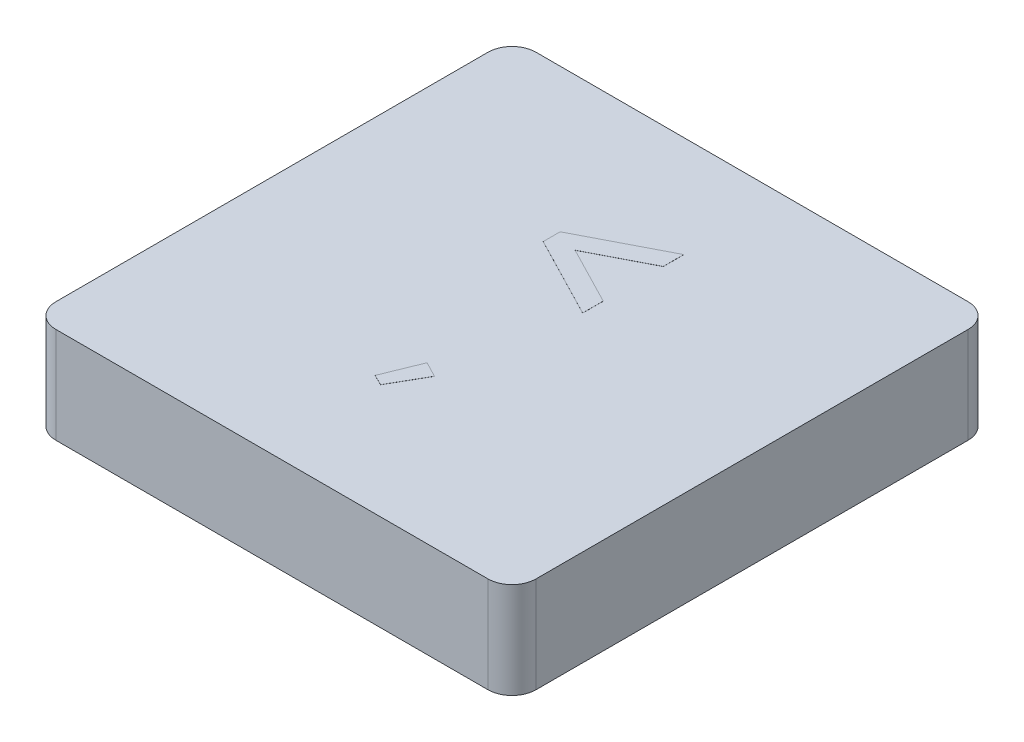
from build123d import *

# Parameters (mm, degrees)
SKETCH1_W           = 12.7
SKETCH1_H           = 12.7
BOSS_EXTRUDE1_DEPTH = 2.54
FILLET1_R           = 0.635
SHELL1_START        = 0.635
SHELL1_OUTLINE_W    = 1.905
SHELL1_OUTLINE_H    = 11.43
SHELL1_DEPTH        = 11.43
SKETCH2_R           = 2.54
BOSS_EXTRUDE2_DEPTH = 1.905
BOSS_EXTRUDE3_DEPTH = 0.00254


# Read off the part's stored shape, not the designer's step: Shell1
with BuildPart() as part:
    # Sketch1 → Boss-Extrude1 (new body)
    with BuildSketch(Plane(origin=(0, 0, 0), x_dir=(1, 0, 0), z_dir=(0, 1, 0))):
        with Locations((6.35, 6.35)):
            Rectangle(SKETCH1_W, SKETCH1_H)
    extrude(amount=BOSS_EXTRUDE1_DEPTH)

    # Fillet1
    fillet1_edges = [part.edges().sort_by_distance(p)[0] for p in [
        (0, 1.27, -12.7),
        (12.7, 1.27, -12.7),
        (12.7, 1.27, 0),
        (0, 1.27, 0),
    ]]
    fillet(fillet1_edges, radius=FILLET1_R)

    # Shell1 outline → Shell1 (cut)
    with BuildSketch(Plane.YZ.offset(SHELL1_START)):
        with Locations((0.9525, -6.35)):
            Rectangle(SHELL1_OUTLINE_W, SHELL1_OUTLINE_H)
    extrude(amount=SHELL1_DEPTH, mode=Mode.SUBTRACT)

    # Sketch2 → Boss-Extrude2 (add)
    with BuildSketch(Plane(origin=(0, 1.905, 0), x_dir=(-1, 0, 0), z_dir=(0, -1, 0))):
        with Locations(Location((-6.35, 6.35, 0), (0, 0, 270))):
            Circle(SKETCH2_R)
    extrude(amount=BOSS_EXTRUDE2_DEPTH)

    # Sketch3 → Boss-Extrude3 (add)
    with BuildSketch(Plane(origin=(0, 2.54, 0), x_dir=(1, 0, 0), z_dir=(0, 1, 0))):
        Polygon((7.227602564, 7.885397436), (7.227602564, 7.341602364), (5.070230769, 8.455269231), (5.070230769, 8.903661659), (7.227602564, 10.017328526), (7.227602564, 9.472897436), (5.689711939, 8.679147436), align=None)
        Polygon((6.310271795, 4.143044271), (6.717323077, 3.932522436), (6.198332692, 3.026833333), (5.91212476, 3.166121194), align=None)
    extrude(amount=BOSS_EXTRUDE3_DEPTH)


solid = part.part
